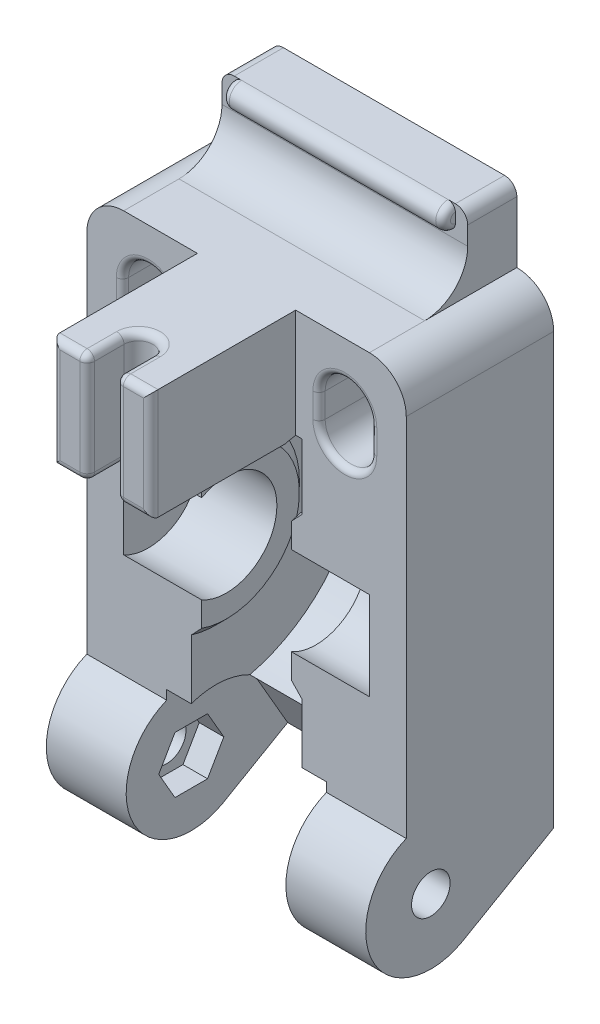
from build123d import *

# Parameters (mm, degrees)
BOSS_EXTRUDE1_DEPTH = 13
BOSS_EXTRUDE7_DEPTH = 9
SKETCH2_R           = 12
CUT_EXTRUDE1_DEPTH  = 4.5
CUT_EXTRUDE3_DEPTH  = 6.5
SKETCH6_R           = 1.57
CUT_EXTRUDE4_DEPTH  = 13
BOSS_EXTRUDE2_DEPTH = 0.85
BOSS_EXTRUDE3_START = 0.85
BOSS_EXTRUDE3_DEPTH = 0.85
SKETCH3_R           = 4.12
BEARING_AXIS_DEPTH  = 10
CHAMFER1_SIZE       = 0.85
CUT_EXTRUDE6_DEPTH  = 2
CUT_EXTRUDE7_DEPTH  = 2
SKETCH15_W          = 20
SKETCH15_H          = 4
BOSS_EXTRUDE4_DEPTH = 6
FILLET1_R           = 3.5
FILLET2_R           = 3
FILLET3_R           = 1
SKETCH16_R          = 1
BOSS_EXTRUDE5_DEPTH = 9
FILLET4_R           = 0.6
CUT_EXTRUDE8_DEPTH  = 12
FILLET5_R           = 0.6
FILLET6_R           = 0.5


with BuildPart() as part:
    # Sketch1 → Boss-Extrude1 (new, symmetric)
    with BuildSketch(Plane(origin=(0, 0, 0), x_dir=(0, 0, -1), z_dir=(1, 0, 0))):
        with BuildLine():
            Line((10, -0.346), (2.551698211, -4.645302599))
            ThreePointArc((2.551698211, -4.645302599), (-4.784687849, -2.279640803), (-2, 4.908156477))
            Line((-2, 4.908156477), (-2, 37.654))
            Line((-2, 37.654), (10, 37.654))
            Line((10, 37.654), (10, -0.346))
        make_face()
    extrude(amount=BOSS_EXTRUDE1_DEPTH, both=True)

    # Sketch17 → Boss-Extrude7 (add)
    with BuildSketch(Plane(origin=(0, 37.654, 0), x_dir=(1, 0, 0), z_dir=(0, 1, 0))):
        with BuildLine():
            Line((-4, -2), (4, -2))
            Line((4, -2), (4, -13.8))
            Line((4, -13.8), (1.175, -13.8))
            Line((1.175, -13.8), (1.175, -10.8))
            ThreePointArc((1.175, -10.8), (0, -9.625), (-1.175, -10.8))
            Line((-1.175, -10.8), (-1.175, -13.8))
            Line((-1.175, -13.8), (-4, -13.8))
            Line((-4, -13.8), (-4, -2))
        make_face()
    extrude(amount=-BOSS_EXTRUDE7_DEPTH)

    # Sketch2 → Cut-Extrude1 (cut, symmetric)
    with BuildSketch(Plane(origin=(0, 0, 0), x_dir=(0, 0, -1), z_dir=(1, 0, 0))):
        with Locations((0, 17)):
            Circle(SKETCH2_R)
    extrude(amount=CUT_EXTRUDE1_DEPTH, both=True, mode=Mode.SUBTRACT)

    # Sketch4 → Cut-Extrude3 (cut, symmetric)
    with BuildSketch(Plane(origin=(0, 0, 0), x_dir=(0, 0, -1), z_dir=(1, 0, 0))):
        with BuildLine():
            Line((5.196447381, 2.99948906), (7.845401268, -1.589675699))
            Line((7.845401268, -1.589675699), (7.845401268, -2.399293943))
            Line((7.845401268, -2.399293943), (2.99948906, -5.196447381))
            ThreePointArc((2.99948906, -5.196447381), (-5.795402235, 1.553484127), (5.196447381, 2.99948906))
        make_face()
    extrude(amount=CUT_EXTRUDE3_DEPTH, both=True, mode=Mode.SUBTRACT)

    # Sketch6 → Cut-Extrude4 (cut, symmetric)
    with BuildSketch(Plane(origin=(0, 0, 0), x_dir=(0, 0, -1), z_dir=(1, 0, 0))):
        Circle(SKETCH6_R)
    extrude(amount=CUT_EXTRUDE4_DEPTH, both=True, mode=Mode.SUBTRACT)

    # Sketch8 → Boss-Extrude2 (add)
    with BuildSketch(Plane(origin=(-4.5, 0, 0), x_dir=(0, 0, -1), z_dir=(1, 0, 0))):
        with BuildLine():
            Line((-2, 23.499230724), (-2, 10.500769276))
            ThreePointArc((-2, 10.500769276), (6.8, 17), (-2, 23.499230724))
        make_face()
    extrude(amount=BOSS_EXTRUDE2_DEPTH)

    # Sketch9 → Boss-Extrude3 (add)
    with BuildSketch(Plane.ZY.offset(-4.5).offset(BOSS_EXTRUDE3_START)):
        with BuildLine():
            Line((2, 23.499230724), (2, 10.500769276))
            ThreePointArc((2, 10.500769276), (-6.8, 17), (2, 23.499230724))
        make_face()
    extrude(amount=-BOSS_EXTRUDE3_DEPTH)

    # Sketch3 → bearing_axis (cut, symmetric)
    with BuildSketch(Plane(origin=(0, 0, 0), x_dir=(0, 0, -1), z_dir=(1, 0, 0))):
        with Locations((0, 17)):
            Circle(SKETCH3_R)
    extrude(amount=BEARING_AXIS_DEPTH, both=True, mode=Mode.SUBTRACT)

    # Chamfer1
    chamfer1_edges = [part.edges().sort_by_distance(p)[0] for p in [
        (3.65, 17, -6.8),
        (-3.65, 17, -6.8),
    ]]
    chamfer(chamfer1_edges, length=CHAMFER1_SIZE - 0.0001)  # a hair under: the kernel refuses the full size

    # Sketch12 → Cut-Extrude6 (cut)
    with BuildSketch(Plane(origin=(-6.5, 0, 0), x_dir=(0, 0, -1), z_dir=(1, 0, 0))):
        Polygon((2.650037736, 0), (1.325018868, 2.295), (-1.325018868, 2.295), (-2.650037736, 0), (-1.325018868, -2.295), (1.325018868, -2.295), align=None)
    extrude(amount=-CUT_EXTRUDE6_DEPTH, mode=Mode.SUBTRACT)

    # Sketch14 → Cut-Extrude7 (cut)
    with BuildSketch(Plane.ZY.offset(-6.5)):
        Polygon((-2.650037736, 0), (-1.325018868, -2.295), (1.325018868, -2.295), (2.650037736, 0), (1.325018868, 2.295), (-1.325018868, 2.295), align=None)
    extrude(amount=-CUT_EXTRUDE7_DEPTH, mode=Mode.SUBTRACT)

    # Sketch15 → Boss-Extrude4 (add)
    with BuildSketch(Plane(origin=(0, 37.654, 0), x_dir=(1, 0, 0), z_dir=(0, 1, 0))):
        with Locations((0, 8)):
            Rectangle(SKETCH15_W, SKETCH15_H)
    extrude(amount=BOSS_EXTRUDE4_DEPTH)

    # Fillet1
    fillet1_edges = [part.edges().sort_by_distance(p)[0] for p in [
        (0, 37.654, -6),
    ]]
    fillet(fillet1_edges, radius=FILLET1_R)

    # Fillet2
    fillet2_edges = [part.edges().sort_by_distance(p)[0] for p in [
        (-13, 37.654, -4),
        (13, 37.654, -4),
    ]]
    fillet(fillet2_edges, radius=FILLET2_R - 0.0001)  # a hair under: the kernel refuses the full size

    # Fillet3
    fillet3_edges = [part.edges().sort_by_distance(p)[0] for p in [
        (-10, 43.654, -8),
        (10, 43.654, -8),
    ]]
    fillet(fillet3_edges, radius=FILLET3_R)

    # Sketch16 → Boss-Extrude5 (add, symmetric)
    with BuildSketch(Plane(origin=(0, 0, 0), x_dir=(0, 0, -1), z_dir=(1, 0, 0))):
        with Locations((6, 42.654)):
            Circle(SKETCH16_R)
    extrude(amount=BOSS_EXTRUDE5_DEPTH, both=True)

    # Fillet4
    fillet4_edges = [part.edges().sort_by_distance(p)[0] for p in [
        (-9, 42.654, -5),
        (9, 42.654, -5),
    ]]
    fillet(fillet4_edges, radius=FILLET4_R)

    # Sketch18 → Cut-Extrude8 (cut)
    with BuildSketch(Plane.XY.offset(-10)):
        with BuildLine():
            Line((-10.1, 30.654), (-10.1, 32.654))
            ThreePointArc((-10.1, 32.654), (-8, 34.754), (-5.9, 32.654))
            Line((-5.9, 32.654), (-5.9, 30.654))
            ThreePointArc((-5.9, 30.654), (-8, 28.554), (-10.1, 30.654))
        make_face()
        with BuildLine():
            Line((10.1, 32.654), (10.1, 30.654))
            ThreePointArc((10.1, 30.654), (8, 28.554), (5.9, 30.654))
            Line((5.9, 30.654), (5.9, 32.654))
            ThreePointArc((5.9, 32.654), (8, 34.754), (10.1, 32.654))
        make_face()
    extrude(amount=CUT_EXTRUDE8_DEPTH, mode=Mode.SUBTRACT)

    # Fillet5
    fillet5_edges = [part.edges().sort_by_distance(p)[0] for p in [
        (2.5875, 28.654, 13.8),
        (4, 33.154, 13.8),
        (1.175, 28.654, 12.3),
        (1.175, 33.154, 13.8),
        (0, 28.654, 9.625),
        (-1.175, 28.654, 12.3),
        (-2.5875, 28.654, 13.8),
        (-1.175, 33.154, 13.8),
        (-4, 33.154, 13.8),
        (2.5875, 37.654, 13.8),
        (-2.5875, 37.654, 13.8),
        (-1.175, 37.654, 12.3),
        (0, 37.654, 9.625),
        (1.175, 37.654, 12.3),
    ]]
    fillet(fillet5_edges, radius=FILLET5_R)

    # Fillet6
    fillet6_edges = [part.edges().sort_by_distance(p)[0] for p in [
        (-10.1, 31.654, 2),
        (-8, 34.754, 2),
        (-5.9, 31.654, 2),
        (-8, 28.554, 2),
        (10.1, 31.654, 2),
        (8, 28.554, 2),
        (5.9, 31.654, 2),
        (8, 34.754, 2),
    ]]
    fillet(fillet6_edges, radius=FILLET6_R)


solid = part.part
